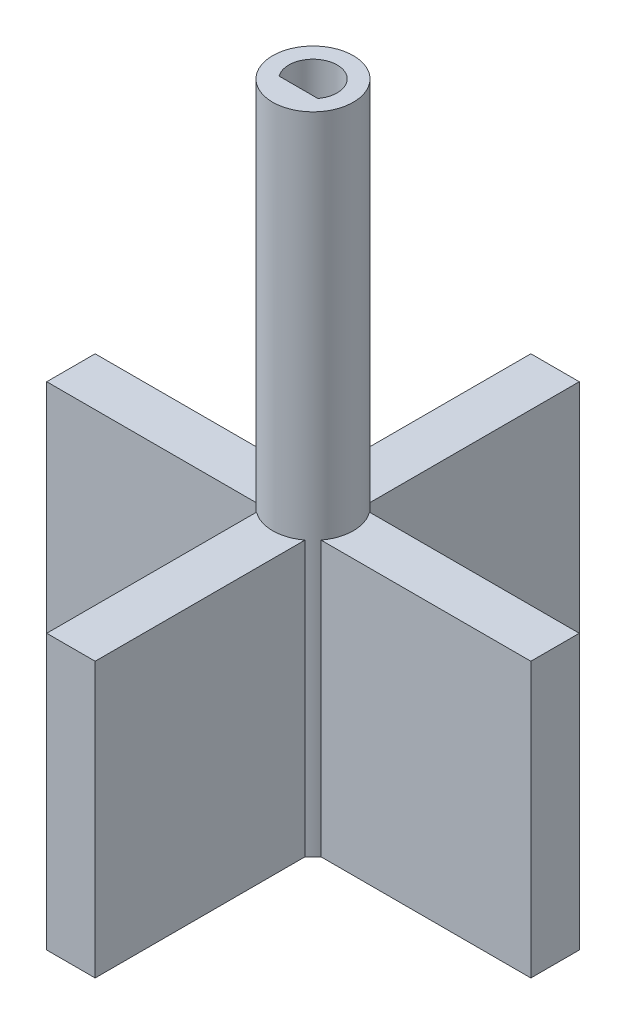
from build123d import *

# Parameters (mm, degrees)
BOSS_EXTRUDE1_DEPTH = 17
SKETCH1_3_R         = 2.5
BOSS_EXTRUDE2_DEPTH = 40


with BuildPart() as part:
    # Sketch1 → Boss-Extrude1 (new body)
    with BuildSketch(Plane(origin=(0, 0, 0), x_dir=(1, 0, 0), z_dir=(0, 1, 0))):
        with BuildLine():
            ThreePointArc((1.5, -1.1), (1.767766953, -0.867766953), (2, -0.6))
            Line((2, -0.6), (15, -0.6))
            Line((15, -0.6), (15, 2.4))
            Line((15, 2.4), (2, 2.4))
            ThreePointArc((2, 2.4), (1.767766953, 2.667766953), (1.5, 2.9))
            Line((1.5, 2.9), (1.5, 15.9))
            Line((1.5, 15.9), (-1.5, 15.9))
            Line((-1.5, 15.9), (-1.5, 2.9))
            ThreePointArc((-1.5, 2.9), (-1.767766953, 2.667766953), (-2, 2.4))
            Line((-2, 2.4), (-15, 2.4))
            Line((-15, 2.4), (-15, -0.6))
            Line((-15, -0.6), (-2, -0.6))
            ThreePointArc((-2, -0.6), (-1.767766953, -0.867766953), (-1.5, -1.1))
            Line((-1.5, -1.1), (-1.5, -14.1))
            Line((-1.5, -14.1), (1.5, -14.1))
            Line((1.5, -14.1), (1.5, -1.1))
        make_face()
        with BuildLine():
            ThreePointArc((-1.2, 0), (0, 2.4), (1.2, 0))
            Line((1.2, 0), (-1.2, 0))
        make_face(mode=Mode.SUBTRACT)
    extrude(amount=BOSS_EXTRUDE1_DEPTH)

    # Sketch1<3> → Boss-Extrude2 (add)
    with BuildSketch(Plane(origin=(0, 0, 0), x_dir=(1, 0, 0), z_dir=(0, 1, 0))):
        with Locations((0, 0.9)):
            Circle(SKETCH1_3_R)
        with BuildLine():
            ThreePointArc((-1.2, 0), (0, 2.4), (1.2, 0))
            Line((1.2, 0), (-1.2, 0))
        make_face(mode=Mode.SUBTRACT)
    extrude(amount=BOSS_EXTRUDE2_DEPTH)


solid = part.part
